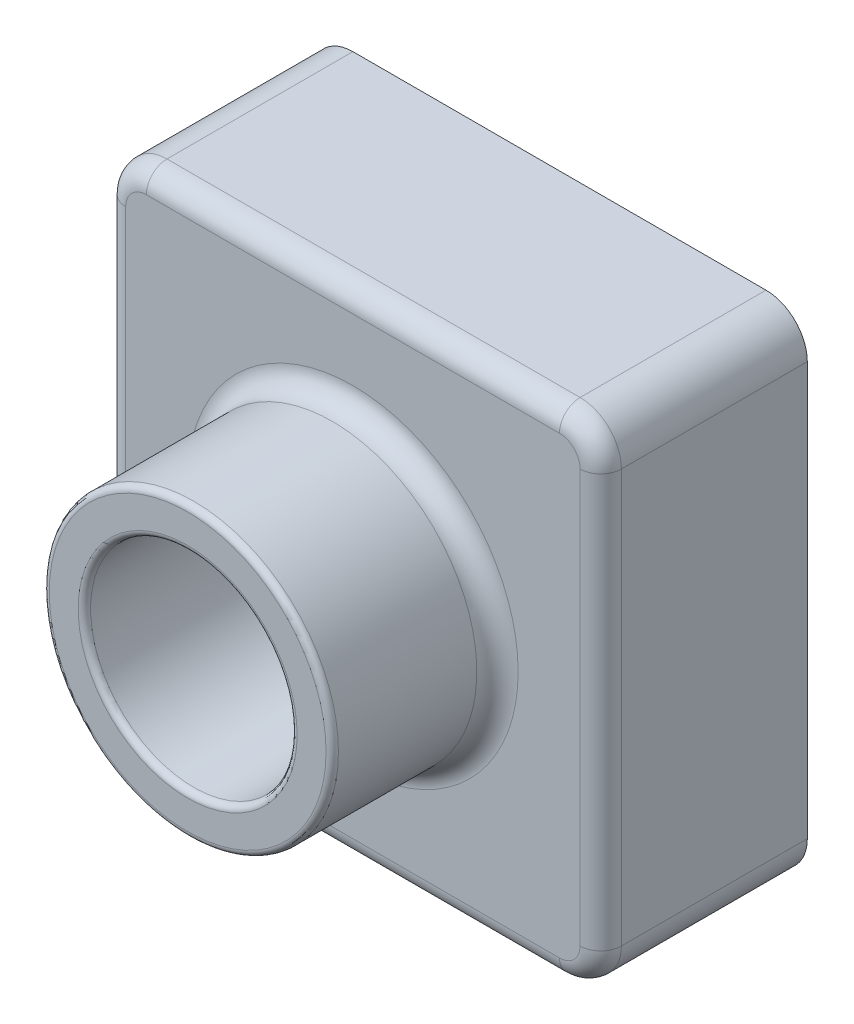
from build123d import *

# Parameters (mm, degrees)
SKETCH4_W           = 120
SKETCH4_H           = 120
BOSS_EXTRUDE3_DEPTH = 50
SKETCH5_R           = 35
BOSS_EXTRUDE4_DEPTH = 40
SKETCH6_R           = 25
CUT_EXTRUDE1_DEPTH  = 193.093727123
FILLET1_R           = 10
FILLET2_R           = 1.5
FILLET3_R           = 5
SHELL1_T            = -2


with BuildPart() as part:
    # Sketch4 → Boss-Extrude3 (new body)
    with BuildSketch(Plane.XY):
        with Locations((60, 60)):
            Rectangle(SKETCH4_W, SKETCH4_H)
    extrude(amount=BOSS_EXTRUDE3_DEPTH)

    # Sketch5 → Boss-Extrude4 (add)
    with BuildSketch(Plane.XY.offset(50)):
        with Locations((60, 60)):
            Circle(SKETCH5_R)
    extrude(amount=BOSS_EXTRUDE4_DEPTH)

    # Sketch6 → Cut-Extrude1 (cut, through all)
    with BuildSketch(Plane.XY.offset(90)):
        with Locations((60, 60)):
            Circle(SKETCH6_R)
    extrude(amount=-CUT_EXTRUDE1_DEPTH, mode=Mode.SUBTRACT)

    # Fillet1
    fillet1_edges = [part.edges().sort_by_distance(p)[0] for p in [
        (120, 0, 25),
        (0, 0, 25),
        (0, 120, 25),
        (120, 120, 25),
    ]]
    fillet(fillet1_edges, radius=FILLET1_R)

    # Fillet2
    fillet2_edges = [part.edges().sort_by_distance(p)[0] for p in [
        (25, 60, 90),
        (35, 60, 90),
    ]]
    fillet(fillet2_edges, radius=FILLET2_R)

    # Fillet3
    fillet3_edges = [part.edges().sort_by_distance(p)[0] for p in [
        (2.928932188, 2.928932188, 50),
        (0, 60, 50),
        (2.928932188, 117.071067812, 50),
        (60, 120, 50),
        (117.071067812, 117.071067812, 50),
        (120, 60, 50),
        (117.071067812, 2.928932188, 50),
        (60, 0, 50),
        (25, 60, 50),
    ]]
    fillet(fillet3_edges, radius=FILLET3_R)

    # Shell1
    shell1_openings = [part.faces().sort_by_distance(p)[0] for p in [
        (60, 1.697056275, 0),
    ]]
    offset(amount=SHELL1_T, openings=shell1_openings, kind=Kind.INTERSECTION)


solid = part.part
